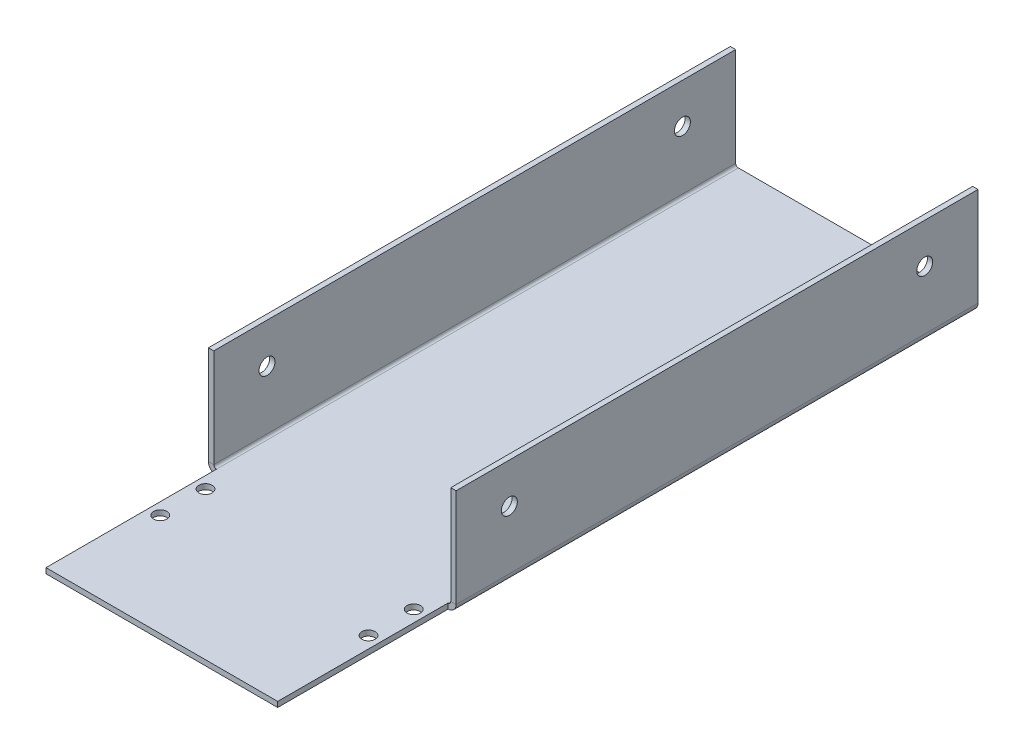
from build123d import *

# Parameters (mm, degrees)
BASE_FLANGE1_DEPTH      = 49
SKETCH8_W               = 43.5
SKETCH8_H               = 1
BOSS_EXTRUDE1_DEPTH     = 32
SKETCH6_R               = 1.25
CUT_EXTRUDE1_DEPTH      = 10
CUT_EXTRUDE3_DEPTH      = 87.611561007
CUT_EXTRUDE3_DEPTH_BACK = 87.611561007
SKETCH9_R               = 1.5
SKETCH7_R               = 1.5
CUT_EXTRUDE2_DEPTH      = 70


# Sheet-metal steps are written as plain solids
with BuildPart() as part:
    # Sketch1 → Base-Flange1 (new, symmetric)
    with BuildSketch(Plane.XY):
        with BuildLine():
            Line((-23.25, 20), (-23.25, 1.5))
            ThreePointArc((-23.25, 1.5), (-22.810660172, 0.439339828), (-21.75, 0))
            Line((-21.75, 0), (21.75, 0))
            ThreePointArc((21.75, 0), (22.810660172, 0.439339828), (23.25, 1.5))
            Line((23.25, 1.5), (23.25, 20))
            Line((23.25, 20), (22.25, 20))
            Line((22.25, 20), (22.25, 1.5))
            ThreePointArc((22.25, 1.5), (22.103553391, 1.146446609), (21.75, 1))
            Line((21.75, 1), (-21.75, 1))
            ThreePointArc((-21.75, 1), (-22.103553391, 1.146446609), (-22.25, 1.5))
            Line((-22.25, 1.5), (-22.25, 20))
            Line((-22.25, 20), (-23.25, 20))
        make_face()
    extrude(amount=BASE_FLANGE1_DEPTH, both=True)

    # Sketch8 → Boss-Extrude1 (add)
    with BuildSketch(Plane.XY.offset(49)):
        with Locations((0, 0.5)):
            Rectangle(SKETCH8_W, SKETCH8_H)
    extrude(amount=BOSS_EXTRUDE1_DEPTH)

    # Sketch6 → Cut-Extrude1 (cut)
    with BuildSketch(Plane.XZ):
        with Locations(Location((19.55, 53.25, 0), (0, 0, 270))):
            Circle(SKETCH6_R)
        with Locations(Location((19.55, 61.75, 0), (0, 0, 270))):
            Circle(SKETCH6_R)
        with Locations(Location((-19.55, 53.25, 0), (0, 0, 270))):
            Circle(SKETCH6_R)
        with Locations(Location((-19.55, 61.75, 0), (0, 0, 270))):
            Circle(SKETCH6_R)
    extrude(amount=-CUT_EXTRUDE1_DEPTH, mode=Mode.SUBTRACT)

    # Sketch9 → Cut-Extrude3 (cut, two sides: drawn at the far end of the back side and taken through both)
    with BuildSketch(Plane(origin=(0, 0, 0), x_dir=(0, 0, -1), z_dir=(1, 0, 0)).offset(-CUT_EXTRUDE3_DEPTH_BACK)):
        with Locations((-39, 12.5)):
            Circle(SKETCH9_R)
    extrude(amount=CUT_EXTRUDE3_DEPTH + CUT_EXTRUDE3_DEPTH_BACK, mode=Mode.SUBTRACT)

    # Sketch7 → Cut-Extrude2 (cut)
    with BuildSketch(Plane(origin=(23.25, 0, 0), x_dir=(0, 0, -1), z_dir=(1, 0, 0))):
        with Locations(Location((39, 12.5, 0), (0, 0, 90))):
            Circle(SKETCH7_R)
    extrude(amount=-CUT_EXTRUDE2_DEPTH, mode=Mode.SUBTRACT)


solid = part.part
